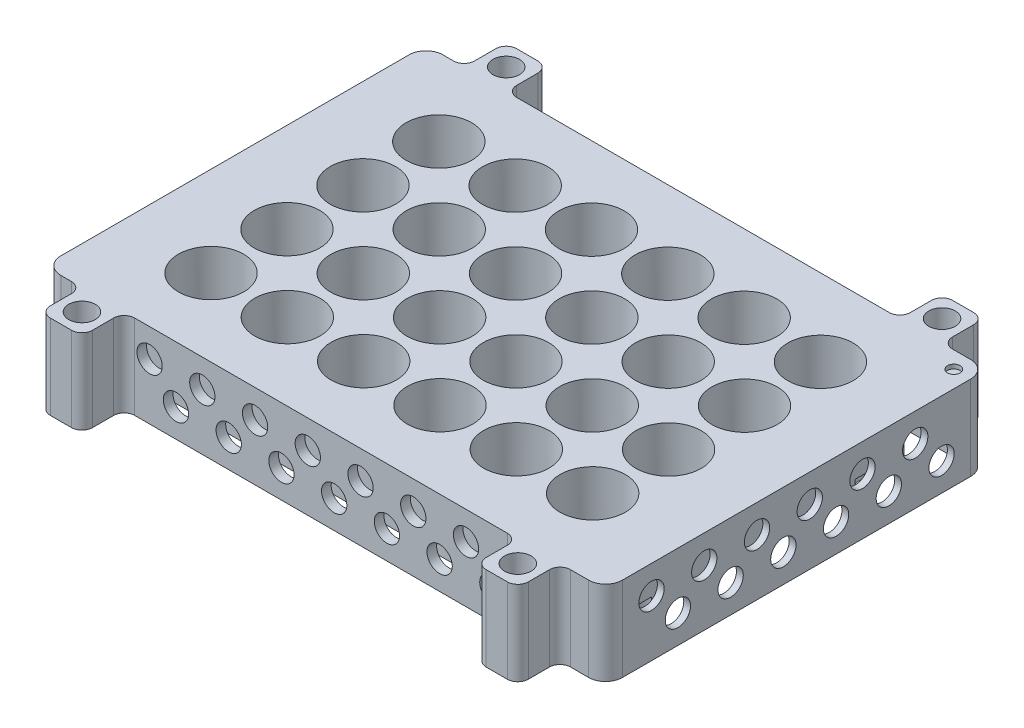
from build123d import *

# Parameters (mm, degrees)
SKETCH1_W           = 157.864
SKETCH1_H           = 90.551
BOSS_EXTRUDE1_DEPTH = 24.5
CUT_EXTRUDE30_DEPTH = 24.5
CUT_EXTRUDE5_START  = -24.5
SKETCH7_R           = 7.75
CUT_EXTRUDE5_DEPTH  = 17
SKETCH23_W          = 129.2861173
SKETCH23_H          = 86.72376579
SKETCH23_W_2        = 111.4861173
SKETCH23_H_2        = 74.72376579
CUT_EXTRUDE21_DEPTH = 4.5
FILLET7_R           = 1
FILLET8_R           = 2.75
SKETCH26_W          = 116.5861173
SKETCH26_H          = 74.72376579
CUT_EXTRUDE22_DEPTH = 3
SKETCH29_W          = 12.37533
SKETCH29_H          = 90.551
CUT_EXTRUDE25_DEPTH = 184.632176094
FILLET9_R           = 4
SKETCH30_W          = 10
SKETCH30_H          = 10
BOSS_EXTRUDE2_DEPTH = 24.5
SKETCH31_R          = 3.15
CUT_EXTRUDE26_DEPTH = 179.543290827
FILLET10_R          = 2.5
SKETCH35_R          = 1.4
BOSS_EXTRUDE3_DEPTH = 0.75
SKETCH37_W          = 236.034585018
SKETCH37_H          = 147.923412956
CUT_EXTRUDE29_DEPTH = 4.5
SKETCH36_W          = 129.28401949
SKETCH36_H          = 86.172693175
SKETCH36_W_2        = 111.787906872
SKETCH36_H_2        = 76.072830146
CUT_EXTRUDE28_DEPTH = 17
FILLET11_R          = 4
FILLET12_R          = 4
SKETCH42_R          = 3.1
CUT_EXTRUDE31_DEPTH = 2.75
SKETCH43_R          = 1.5
CUT_EXTRUDE32_DEPTH = 1
SKETCH44_R          = 3
CUT_EXTRUDE33_DEPTH = 2.220919758
SKETCH45_R          = 3
CUT_EXTRUDE34_DEPTH = 2.286228198
CUT_EXTRUDE35_START = -1.608400752
SKETCH46_R          = 3
CUT_EXTRUDE35_DEPTH = 1.608400752
SKETCH47_R          = 3
CUT_EXTRUDE36_DEPTH = 2.092078627


with BuildPart() as part:
    # Sketch1 → Boss-Extrude1 (new body)
    with BuildSketch(Plane(origin=(0, 0, 0), x_dir=(1, 0, 0), z_dir=(0, 1, 0))):
        with Locations((78.932, -45.2755)):
            Rectangle(SKETCH1_W, SKETCH1_H)
    extrude(amount=BOSS_EXTRUDE1_DEPTH)

    # Sketch39 → Cut-Extrude30 (cut)
    with BuildSketch(Plane(origin=(0, 24.5, 0), x_dir=(1, 0, 0), z_dir=(0, 1, 0))):
        Polygon((37.005804, -18.5555), (30.948984, -18.5555), (30.408196, -19.088448), (30.408196, -25.18537), (37.005804, -25.18537), align=None)
        Polygon((55.095804, -11.36563), (49.038984, -11.36563), (48.498196, -11.898578), (48.498196, -17.9955), (55.095804, -17.9955), align=None)
        Polygon((73.185804, -11.36563), (67.128984, -11.36563), (66.588196, -11.898578), (66.588196, -17.9955), (73.185804, -17.9955), align=None)
        Polygon((91.275804, -11.36563), (85.218984, -11.36563), (84.678196, -11.898578), (84.678196, -17.9955), (91.275804, -17.9955), align=None)
        Polygon((109.365804, -11.36563), (103.308984, -11.36563), (102.768196, -11.898578), (102.768196, -17.9955), (109.365804, -17.9955), align=None)
        Polygon((127.455804, -11.36563), (121.398984, -11.36563), (120.858196, -11.898578), (120.858196, -17.9955), (127.455804, -17.9955), align=None)
        Polygon((55.095804, -29.36563), (49.038984, -29.36563), (48.498196, -29.898578), (48.498196, -35.9955), (55.095804, -35.9955), align=None)
        Polygon((73.185804, -29.36563), (67.128984, -29.36563), (66.588196, -29.898578), (66.588196, -35.9955), (73.185804, -35.9955), align=None)
        Polygon((91.275804, -29.36563), (85.218984, -29.36563), (84.678196, -29.898578), (84.678196, -35.9955), (91.275804, -35.9955), align=None)
        Polygon((109.365804, -29.36563), (103.308984, -29.36563), (102.768196, -29.898578), (102.768196, -35.9955), (109.365804, -35.9955), align=None)
        Polygon((127.455804, -29.36563), (121.398984, -29.36563), (120.858196, -29.898578), (120.858196, -35.9955), (127.455804, -35.9955), align=None)
        Polygon((55.095804, -47.36563), (49.038984, -47.36563), (48.498196, -47.898578), (48.498196, -53.9955), (55.095804, -53.9955), align=None)
        Polygon((73.185804, -47.36563), (67.128984, -47.36563), (66.588196, -47.898578), (66.588196, -53.9955), (73.185804, -53.9955), align=None)
        Polygon((91.275804, -47.36563), (85.218984, -47.36563), (84.678196, -47.898578), (84.678196, -53.9955), (91.275804, -53.9955), align=None)
        Polygon((109.365804, -47.36563), (103.308984, -47.36563), (102.768196, -47.898578), (102.768196, -53.9955), (109.365804, -53.9955), align=None)
        Polygon((127.455804, -47.36563), (121.398984, -47.36563), (120.858196, -47.898578), (120.858196, -53.9955), (127.455804, -53.9955), align=None)
        Polygon((55.095804, -65.36563), (49.038984, -65.36563), (48.498196, -65.898578), (48.498196, -71.9955), (55.095804, -71.9955), align=None)
        Polygon((73.185804, -65.36563), (67.128984, -65.36563), (66.588196, -65.898578), (66.588196, -71.9955), (73.185804, -71.9955), align=None)
        Polygon((91.275804, -65.36563), (85.218984, -65.36563), (84.678196, -65.898578), (84.678196, -71.9955), (91.275804, -71.9955), align=None)
        Polygon((109.365804, -65.36563), (103.308984, -65.36563), (102.768196, -65.898578), (102.768196, -71.9955), (109.365804, -71.9955), align=None)
        Polygon((127.455804, -65.36563), (121.398984, -65.36563), (120.858196, -65.898578), (120.858196, -71.9955), (127.455804, -71.9955), align=None)
        Polygon((37.005804, -29.36563), (30.948984, -29.36563), (30.408196, -29.898578), (30.408196, -35.9955), (37.005804, -35.9955), align=None)
        Polygon((37.005804, -47.36563), (30.948984, -47.36563), (30.408196, -47.898578), (30.408196, -53.9955), (37.005804, -53.9955), align=None)
        Polygon((37.005804, -65.36563), (30.948984, -65.36563), (30.408196, -65.898578), (30.408196, -71.9955), (37.005804, -71.9955), align=None)
        Polygon((37.005804, -11.36563), (30.948984, -11.36563), (30.408196, -11.898578), (30.408196, -17.9955), (37.005804, -17.9955), align=None)
        Polygon((48.498196, -25.18537), (55.095804, -25.18537), (55.095804, -18.5555), (49.038984, -18.5555), (48.498196, -19.088448), align=None)
        Polygon((66.588196, -25.18537), (73.185804, -25.18537), (73.185804, -18.5555), (67.128984, -18.5555), (66.588196, -19.088448), align=None)
        Polygon((84.678196, -25.18537), (91.275804, -25.18537), (91.275804, -18.5555), (85.218984, -18.5555), (84.678196, -19.088448), align=None)
        Polygon((102.768196, -25.18537), (109.365804, -25.18537), (109.365804, -18.5555), (103.308984, -18.5555), (102.768196, -19.088448), align=None)
        Polygon((120.858196, -25.18537), (127.455804, -25.18537), (127.455804, -18.5555), (121.398984, -18.5555), (120.858196, -19.088448), align=None)
        Polygon((48.498196, -43.18537), (55.095804, -43.18537), (55.095804, -36.5555), (49.038984, -36.5555), (48.498196, -37.088448), align=None)
        Polygon((66.588196, -43.18537), (73.185804, -43.18537), (73.185804, -36.5555), (67.128984, -36.5555), (66.588196, -37.088448), align=None)
        Polygon((84.678196, -43.18537), (91.275804, -43.18537), (91.275804, -36.5555), (85.218984, -36.5555), (84.678196, -37.088448), align=None)
        Polygon((102.768196, -43.18537), (109.365804, -43.18537), (109.365804, -36.5555), (103.308984, -36.5555), (102.768196, -37.088448), align=None)
        Polygon((120.858196, -43.18537), (127.455804, -43.18537), (127.455804, -36.5555), (121.398984, -36.5555), (120.858196, -37.088448), align=None)
        Polygon((48.498196, -61.18537), (55.095804, -61.18537), (55.095804, -54.5555), (49.038984, -54.5555), (48.498196, -55.088448), align=None)
        Polygon((66.588196, -61.18537), (73.185804, -61.18537), (73.185804, -54.5555), (67.128984, -54.5555), (66.588196, -55.088448), align=None)
        Polygon((84.678196, -61.18537), (91.275804, -61.18537), (91.275804, -54.5555), (85.218984, -54.5555), (84.678196, -55.088448), align=None)
        Polygon((102.768196, -61.18537), (109.365804, -61.18537), (109.365804, -54.5555), (103.308984, -54.5555), (102.768196, -55.088448), align=None)
        Polygon((120.858196, -61.18537), (127.455804, -61.18537), (127.455804, -54.5555), (121.398984, -54.5555), (120.858196, -55.088448), align=None)
        Polygon((48.498196, -79.18537), (55.095804, -79.18537), (55.095804, -72.5555), (49.038984, -72.5555), (48.498196, -73.088448), align=None)
        Polygon((66.588196, -79.18537), (73.185804, -79.18537), (73.185804, -72.5555), (67.128984, -72.5555), (66.588196, -73.088448), align=None)
        Polygon((84.678196, -79.18537), (91.275804, -79.18537), (91.275804, -72.5555), (85.218984, -72.5555), (84.678196, -73.088448), align=None)
        Polygon((102.768196, -79.18537), (109.365804, -79.18537), (109.365804, -72.5555), (103.308984, -72.5555), (102.768196, -73.088448), align=None)
        Polygon((120.858196, -79.18537), (127.455804, -79.18537), (127.455804, -72.5555), (121.398984, -72.5555), (120.858196, -73.088448), align=None)
        Polygon((30.408196, -43.18537), (37.005804, -43.18537), (37.005804, -36.5555), (30.948984, -36.5555), (30.408196, -37.088448), align=None)
        Polygon((30.408196, -61.18537), (37.005804, -61.18537), (37.005804, -54.5555), (30.948984, -54.5555), (30.408196, -55.088448), align=None)
        Polygon((30.408196, -79.18537), (37.005804, -79.18537), (37.005804, -72.5555), (30.948984, -72.5555), (30.408196, -73.088448), align=None)
    extrude(amount=-CUT_EXTRUDE30_DEPTH, mode=Mode.SUBTRACT)

    # Sketch7 → Cut-Extrude5 (cut)
    with BuildSketch(Plane.XZ.offset(CUT_EXTRUDE5_START)):
        with Locations(Location((33.707, 72.2755, 0), (0, 0, 90))):
            Circle(SKETCH7_R)
        with Locations(Location((51.797, 72.2755, 0), (0, 0, 90))):
            Circle(SKETCH7_R)
        with Locations(Location((69.887, 72.2755, 0), (0, 0, 90))):
            Circle(SKETCH7_R)
        with Locations(Location((87.977, 72.2755, 0), (0, 0, 90))):
            Circle(SKETCH7_R)
        with Locations(Location((106.067, 72.2755, 0), (0, 0, 90))):
            Circle(SKETCH7_R)
        with Locations(Location((124.157, 72.2755, 0), (0, 0, 90))):
            Circle(SKETCH7_R)
        with Locations(Location((51.797, 54.2755, 0), (0, 0, 90))):
            Circle(SKETCH7_R)
        with Locations(Location((69.887, 54.2755, 0), (0, 0, 90))):
            Circle(SKETCH7_R)
        with Locations(Location((87.977, 54.2755, 0), (0, 0, 90))):
            Circle(SKETCH7_R)
        with Locations(Location((106.067, 54.2755, 0), (0, 0, 90))):
            Circle(SKETCH7_R)
        with Locations(Location((124.157, 54.2755, 0), (0, 0, 90))):
            Circle(SKETCH7_R)
        with Locations(Location((51.797, 36.2755, 0), (0, 0, 90))):
            Circle(SKETCH7_R)
        with Locations(Location((69.887, 36.2755, 0), (0, 0, 90))):
            Circle(SKETCH7_R)
        with Locations(Location((87.977, 36.2755, 0), (0, 0, 90))):
            Circle(SKETCH7_R)
        with Locations(Location((106.067, 36.2755, 0), (0, 0, 90))):
            Circle(SKETCH7_R)
        with Locations(Location((124.157, 36.2755, 0), (0, 0, 90))):
            Circle(SKETCH7_R)
        with Locations(Location((51.797, 18.2755, 0), (0, 0, 90))):
            Circle(SKETCH7_R)
        with Locations(Location((69.887, 18.2755, 0), (0, 0, 90))):
            Circle(SKETCH7_R)
        with Locations(Location((87.977, 18.2755, 0), (0, 0, 90))):
            Circle(SKETCH7_R)
        with Locations(Location((106.067, 18.2755, 0), (0, 0, 90))):
            Circle(SKETCH7_R)
        with Locations(Location((124.157, 18.2755, 0), (0, 0, 90))):
            Circle(SKETCH7_R)
        with Locations(Location((33.707, 54.2755, 0), (0, 0, 90))):
            Circle(SKETCH7_R)
        with Locations(Location((33.707, 36.2755, 0), (0, 0, 90))):
            Circle(SKETCH7_R)
        with Locations(Location((33.707, 18.2755, 0), (0, 0, 90))):
            Circle(SKETCH7_R)
    extrude(amount=CUT_EXTRUDE5_DEPTH, mode=Mode.SUBTRACT)

    # Sketch23 → Cut-Extrude21 (cut)
    with BuildSketch(Plane(origin=(0, 24.5, 0), x_dir=(1, 0, 0), z_dir=(0, 1, 0))):
        with Locations((78.93200135, -45.275497105)):
            Rectangle(SKETCH23_W, SKETCH23_H)
        with Locations((78.93200135, -45.275497105)):
            Rectangle(SKETCH23_W_2, SKETCH23_H_2, mode=Mode.SUBTRACT)
    extrude(amount=-CUT_EXTRUDE21_DEPTH, mode=Mode.SUBTRACT)

    # Fillet7
    fillet7_edges = [part.edges().sort_by_distance(p)[0] for p in [
        (134.67506, 22.25, 82.63738),
        (23.1889427, 22.25, 82.63738),
        (23.1889427, 22.25, 7.91361421),
        (134.67506, 22.25, 7.91361421),
    ]]
    fillet(fillet7_edges, radius=FILLET7_R)

    # Fillet8
    fillet8_edges = [part.edges().sort_by_distance(p)[0] for p in [
        (143.57506, 22.25, 1.91361421),
        (143.57506, 22.25, 88.63738),
        (14.2889427, 22.25, 88.63738),
        (14.2889427, 22.25, 1.91361421),
    ]]
    fillet(fillet8_edges, radius=FILLET8_R)

    # Sketch26 → Cut-Extrude22 (cut)
    with BuildSketch(Plane(origin=(0, 24.5, 0), x_dir=(1, 0, 0), z_dir=(0, 1, 0))):
        with Locations((76.38200135, -45.275497105)):
            Rectangle(SKETCH26_W, SKETCH26_H)
    extrude(amount=-CUT_EXTRUDE22_DEPTH, mode=Mode.SUBTRACT)

    # Sketch29 → Cut-Extrude25 (cut, through all)
    with BuildSketch(Plane(origin=(0, 24.5, 0), x_dir=(1, 0, 0), z_dir=(0, 1, 0))):
        with Locations((151.676335, -45.2755)):
            Rectangle(SKETCH29_W, SKETCH29_H)
        with Locations((6.187665, -45.2755)):
            Rectangle(SKETCH29_W, SKETCH29_H)
    extrude(amount=-CUT_EXTRUDE25_DEPTH, mode=Mode.SUBTRACT)

    # Fillet9
    fillet9_edges = [part.edges().sort_by_distance(p)[0] for p in [
        (145.48867, 12.25, 90.551),
        (145.48867, 12.25, 0),
        (12.37533, 12.25, 0),
        (12.37533, 12.25, 90.551),
    ]]
    fillet(fillet9_edges, radius=FILLET9_R)

    # Sketch30 → Boss-Extrude2 (add, through all)
    with BuildSketch(Plane.XZ):
        with Locations((129.6936, -5)):
            Rectangle(SKETCH30_W, SKETCH30_H)
        with Locations((26.3936, -5)):
            Rectangle(SKETCH30_W, SKETCH30_H)
        with Locations((129.6936, 95.551)):
            Rectangle(SKETCH30_W, SKETCH30_H)
        with Locations((26.3936, 95.551)):
            Rectangle(SKETCH30_W, SKETCH30_H)
    extrude(amount=-BOSS_EXTRUDE2_DEPTH)

    # Sketch31 → Cut-Extrude26 (cut, through all)
    with BuildSketch(Plane(origin=(0, 24.5, 0), x_dir=(1, 0, 0), z_dir=(0, 1, 0))):
        with Locations(Location((26.3936, 5, 0), (0, 0, 270))):
            Circle(SKETCH31_R)
        with Locations(Location((129.6936, 5, 0), (0, 0, 270))):
            Circle(SKETCH31_R)
        with Locations(Location((26.3936, -95.551, 0), (0, 0, 270))):
            Circle(SKETCH31_R)
        with Locations(Location((129.6936, -95.551, 0), (0, 0, 270))):
            Circle(SKETCH31_R)
    extrude(amount=-CUT_EXTRUDE26_DEPTH, mode=Mode.SUBTRACT)

    # Fillet10
    fillet10_edges = [part.edges().sort_by_distance(p)[0] for p in [
        (134.6936, 12.25, 0),
        (134.6936, 12.25, -10),
        (124.6936, 12.25, -10),
        (124.6936, 12.25, 0),
        (21.3936, 12.25, -10),
        (21.3936, 12.25, 0),
        (31.3936, 12.25, 0),
        (31.3936, 12.25, -10),
        (134.6936, 12.25, 100.551),
        (134.6936, 12.25, 90.551),
        (124.6936, 12.25, 90.551),
        (124.6936, 12.25, 100.551),
        (21.3936, 12.25, 90.551),
        (21.3936, 12.25, 100.551),
        (31.3936, 12.25, 100.551),
        (31.3936, 12.25, 90.551),
    ]]
    fillet(fillet10_edges, radius=FILLET10_R)

    # Sketch35 → Boss-Extrude3 (add)
    with BuildSketch(Plane(origin=(0, 21.5, 0), x_dir=(1, 0, 0), z_dir=(0, 1, 0))):
        with Locations(Location((115.112, -27.2755, 0), (0, 0, 90))):
            Circle(SKETCH35_R)
        with Locations(Location((42.752, -63.2755, 0), (0, 0, 90))):
            Circle(SKETCH35_R)
    extrude(amount=BOSS_EXTRUDE3_DEPTH)

    # Sketch37 → Cut-Extrude29 (cut)
    with BuildSketch(Plane(origin=(0, 24.5, 0), x_dir=(1, 0, 0), z_dir=(0, 1, 0))):
        with Locations((96.643531952, -44.613547987)):
            Rectangle(SKETCH37_W, SKETCH37_H)
    extrude(amount=-CUT_EXTRUDE29_DEPTH, mode=Mode.SUBTRACT)

    # Sketch36 → Cut-Extrude28 (cut)
    with BuildSketch(Plane.XZ):
        with Locations((79.238259503, 45.178425215)):
            Rectangle(SKETCH36_W, SKETCH36_H)
        with Locations((79.238259503, 45.178425215)):
            Rectangle(SKETCH36_W_2, SKETCH36_H_2, mode=Mode.SUBTRACT)
    extrude(amount=-CUT_EXTRUDE28_DEPTH, mode=Mode.SUBTRACT)

    # Fillet11
    fillet11_edges = [part.edges().sort_by_distance(p)[0] for p in [
        (23.344306067, 8.5, 83.214840288),
        (135.132212939, 8.5, 83.214840288),
        (135.132212939, 8.5, 7.142010142),
        (23.344306067, 8.5, 7.142010142),
    ]]
    fillet(fillet11_edges, radius=FILLET11_R)

    # Fillet12
    fillet12_edges = [part.edges().sort_by_distance(p)[0] for p in [
        (14.596249758, 8.5, 2.092078627),
        (14.596249758, 8.5, 88.264771802),
        (143.880269248, 8.5, 88.264771802),
        (143.880269248, 8.5, 2.092078627),
    ]]
    fillet(fillet12_edges, radius=FILLET12_R)

    # Sketch42 → Cut-Extrude31 (cut)
    with BuildSketch(Plane.XZ):
        with Locations((22.183259503, 72.173425215)):
            Circle(SKETCH42_R)
        with Locations((22.183259503, 18.183425215)):
            Circle(SKETCH42_R)
        with Locations((136.293259503, 18.183425215)):
            Circle(SKETCH42_R)
        with Locations((136.293259503, 72.173425215)):
            Circle(SKETCH42_R)
    extrude(amount=-CUT_EXTRUDE31_DEPTH, mode=Mode.SUBTRACT)

    # Sketch43 → Cut-Extrude32 (cut)
    with BuildSketch(Plane(origin=(0, 20, 0), x_dir=(1, 0, 0), z_dir=(0, 1, 0))):
        with Locations(Location((141.48867, -4, 0), (0, 0, 270))):
            Circle(SKETCH43_R)
    extrude(amount=-CUT_EXTRUDE32_DEPTH, mode=Mode.SUBTRACT)

    # Sketch44 → Cut-Extrude33 (cut)
    with BuildSketch(Plane.ZY.offset(-12.37533)):
        with Locations((10.9005, 6.666666667)):
            Circle(SKETCH44_R)
        with Locations((23.4005, 6.666666667)):
            Circle(SKETCH44_R)
        with Locations((35.9005, 6.666666667)):
            Circle(SKETCH44_R)
        with Locations((48.4005, 6.666666667)):
            Circle(SKETCH44_R)
        with Locations((60.9005, 6.666666667)):
            Circle(SKETCH44_R)
        with Locations((73.4005, 6.666666667)):
            Circle(SKETCH44_R)
        with Locations((17.1505, 13.333333333)):
            Circle(SKETCH44_R)
        with Locations((29.6505, 13.333333333)):
            Circle(SKETCH44_R)
        with Locations((42.1505, 13.333333333)):
            Circle(SKETCH44_R)
        with Locations((54.6505, 13.333333333)):
            Circle(SKETCH44_R)
        with Locations((67.1505, 13.333333333)):
            Circle(SKETCH44_R)
        with Locations((79.6505, 13.333333333)):
            Circle(SKETCH44_R)
    extrude(amount=-CUT_EXTRUDE33_DEPTH, mode=Mode.SUBTRACT)

    # Sketch45 → Cut-Extrude34 (cut)
    with BuildSketch(Plane.XY.offset(90.551)):
        with Locations((37.4186, 13.333333333)):
            Circle(SKETCH45_R)
        with Locations((49.9186, 13.333333333)):
            Circle(SKETCH45_R)
        with Locations((62.4186, 13.333333333)):
            Circle(SKETCH45_R)
        with Locations((74.9186, 13.333333333)):
            Circle(SKETCH45_R)
        with Locations((87.4186, 13.333333333)):
            Circle(SKETCH45_R)
        with Locations((99.9186, 13.333333333)):
            Circle(SKETCH45_R)
        with Locations((112.4186, 13.333333333)):
            Circle(SKETCH45_R)
        with Locations((43.6686, 6.666666667)):
            Circle(SKETCH45_R)
        with Locations((56.1686, 6.666666667)):
            Circle(SKETCH45_R)
        with Locations((68.6686, 6.666666667)):
            Circle(SKETCH45_R)
        with Locations((81.1686, 6.666666667)):
            Circle(SKETCH45_R)
        with Locations((93.6686, 6.666666667)):
            Circle(SKETCH45_R)
        with Locations((106.1686, 6.666666667)):
            Circle(SKETCH45_R)
        with Locations((118.6686, 6.666666667)):
            Circle(SKETCH45_R)
    extrude(amount=-CUT_EXTRUDE34_DEPTH, mode=Mode.SUBTRACT)

    # Sketch46 → Cut-Extrude35 (cut)
    with BuildSketch(Plane(origin=(145.48867, 0, 0), x_dir=(0, 0, -1), z_dir=(1, 0, 0)).offset(CUT_EXTRUDE35_START)):
        with Locations(Location((-79.6505, 13.333333333, 0), (0, 0, 180))):
            Circle(SKETCH46_R)
        with Locations(Location((-67.1505, 13.333333333, 0), (0, 0, 180))):
            Circle(SKETCH46_R)
        with Locations(Location((-54.6505, 13.333333333, 0), (0, 0, 180))):
            Circle(SKETCH46_R)
        with Locations(Location((-42.1505, 13.333333333, 0), (0, 0, 180))):
            Circle(SKETCH46_R)
        with Locations(Location((-29.6505, 13.333333333, 0), (0, 0, 180))):
            Circle(SKETCH46_R)
        with Locations(Location((-73.4005, 6.666666667, 0), (0, 0, 180))):
            Circle(SKETCH46_R)
        with Locations(Location((-17.1505, 13.333333333, 0), (0, 0, 180))):
            Circle(SKETCH46_R)
        with Locations(Location((-60.9005, 6.666666667, 0), (0, 0, 180))):
            Circle(SKETCH46_R)
        with Locations(Location((-48.4005, 6.666666667, 0), (0, 0, 180))):
            Circle(SKETCH46_R)
        with Locations(Location((-35.9005, 6.666666667, 0), (0, 0, 180))):
            Circle(SKETCH46_R)
        with Locations(Location((-23.4005, 6.666666667, 0), (0, 0, 180))):
            Circle(SKETCH46_R)
        with Locations(Location((-10.9005, 6.666666667, 0), (0, 0, 180))):
            Circle(SKETCH46_R)
    extrude(amount=CUT_EXTRUDE35_DEPTH, mode=Mode.SUBTRACT)

    # Sketch47 → Cut-Extrude36 (cut)
    with BuildSketch(Plane(origin=(0, 0, 0), x_dir=(-1, 0, 0), z_dir=(0, 0, -1))):
        with Locations((-118.6686, 13.333333333)):
            Circle(SKETCH47_R)
        with Locations((-43.6686, 13.333333333)):
            Circle(SKETCH47_R)
        with Locations((-81.1686, 13.333333333)):
            Circle(SKETCH47_R)
        with Locations((-68.6686, 13.333333333)):
            Circle(SKETCH47_R)
        with Locations((-56.1686, 13.333333333)):
            Circle(SKETCH47_R)
        with Locations((-93.6686, 13.333333333)):
            Circle(SKETCH47_R)
        with Locations((-106.1686, 13.333333333)):
            Circle(SKETCH47_R)
        with Locations((-112.4186, 6.666666667)):
            Circle(SKETCH47_R)
        with Locations((-99.9186, 6.666666667)):
            Circle(SKETCH47_R)
        with Locations((-87.4186, 6.666666667)):
            Circle(SKETCH47_R)
        with Locations((-74.9186, 6.666666667)):
            Circle(SKETCH47_R)
        with Locations((-62.4186, 6.666666667)):
            Circle(SKETCH47_R)
        with Locations((-49.9186, 6.666666667)):
            Circle(SKETCH47_R)
        with Locations((-37.4186, 6.666666667)):
            Circle(SKETCH47_R)
    extrude(amount=-CUT_EXTRUDE36_DEPTH, mode=Mode.SUBTRACT)


solid = part.part
